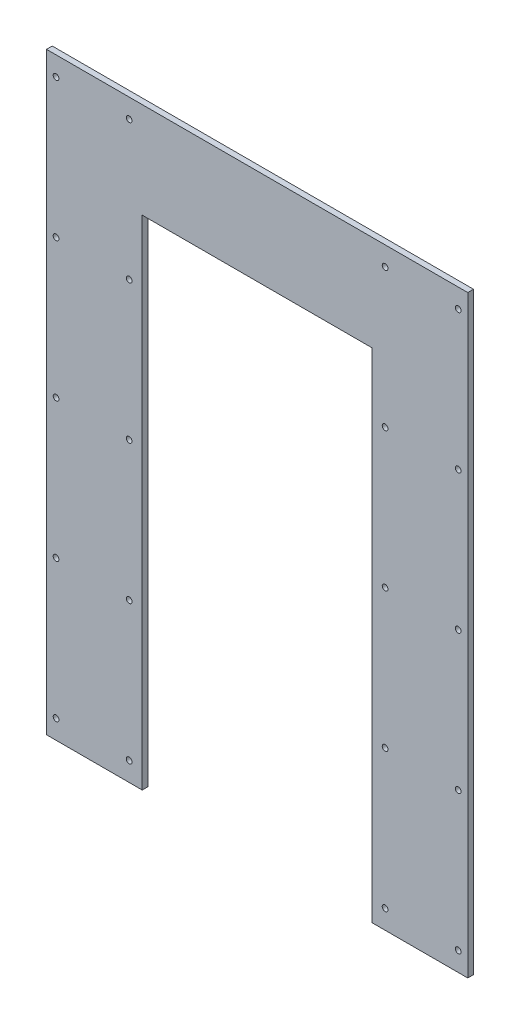
from build123d import *

# Parameters (mm, degrees)
BOSS_EXTRU_1_DEPTH      = 3
ENL_V_MAT_EXTRU_1_REACH = 251.116
ESQUISSE2_R             = 1.5


with BuildPart() as part:
    # Esquisse1 → Boss.-Extru.1 (new body)
    with BuildSketch(Plane.XY):
        Polygon((-25, -155), (25, -155), (25, 105), (145, 105), (145, -155), (195, -155), (195, 155), (145, 155), (25, 155), (-25, 155), align=None)
    extrude(amount=BOSS_EXTRU_1_DEPTH)

    # Esquisse2 → Enlèv. mat.-Extru.1 (cut, up to next)
    with BuildSketch(Plane.XY.offset(3), mode=Mode.PRIVATE) as enl_v_mat_extru_1_sk1:
        with Locations((-20, -145)):
            Circle(ESQUISSE2_R)
    enl_v_mat_extru_1_tool1 = extrude(enl_v_mat_extru_1_sk1.sketch, amount=-ENL_V_MAT_EXTRU_1_REACH, mode=Mode.PRIVATE) & part.part
    # Esquisse2 → Enlèv. mat.-Extru.1 (cut, up to next)
    with BuildSketch(Plane.XY.offset(3), mode=Mode.PRIVATE) as enl_v_mat_extru_1_sk2:
        with Locations((-20, -72.5)):
            Circle(ESQUISSE2_R)
    enl_v_mat_extru_1_tool2 = extrude(enl_v_mat_extru_1_sk2.sketch, amount=-ENL_V_MAT_EXTRU_1_REACH, mode=Mode.PRIVATE) & part.part
    # Esquisse2 → Enlèv. mat.-Extru.1 (cut, up to next)
    with BuildSketch(Plane.XY.offset(3), mode=Mode.PRIVATE) as enl_v_mat_extru_1_sk3:
        with Locations((-20, 0)):
            Circle(ESQUISSE2_R)
    enl_v_mat_extru_1_tool3 = extrude(enl_v_mat_extru_1_sk3.sketch, amount=-ENL_V_MAT_EXTRU_1_REACH, mode=Mode.PRIVATE) & part.part
    # Esquisse2 → Enlèv. mat.-Extru.1 (cut, up to next)
    with BuildSketch(Plane.XY.offset(3), mode=Mode.PRIVATE) as enl_v_mat_extru_1_sk4:
        with Locations((-20, 72.5)):
            Circle(ESQUISSE2_R)
    enl_v_mat_extru_1_tool4 = extrude(enl_v_mat_extru_1_sk4.sketch, amount=-ENL_V_MAT_EXTRU_1_REACH, mode=Mode.PRIVATE) & part.part
    # Esquisse2 → Enlèv. mat.-Extru.1 (cut, up to next)
    with BuildSketch(Plane.XY.offset(3), mode=Mode.PRIVATE) as enl_v_mat_extru_1_sk5:
        with Locations((-20, 145)):
            Circle(ESQUISSE2_R)
    enl_v_mat_extru_1_tool5 = extrude(enl_v_mat_extru_1_sk5.sketch, amount=-ENL_V_MAT_EXTRU_1_REACH, mode=Mode.PRIVATE) & part.part
    # Esquisse2 → Enlèv. mat.-Extru.1 (cut, up to next)
    with BuildSketch(Plane.XY.offset(3), mode=Mode.PRIVATE) as enl_v_mat_extru_1_sk6:
        with Locations((18.166845856, 145)):
            Circle(ESQUISSE2_R)
    enl_v_mat_extru_1_tool6 = extrude(enl_v_mat_extru_1_sk6.sketch, amount=-ENL_V_MAT_EXTRU_1_REACH, mode=Mode.PRIVATE) & part.part
    # Esquisse2 → Enlèv. mat.-Extru.1 (cut, up to next)
    with BuildSketch(Plane.XY.offset(3), mode=Mode.PRIVATE) as enl_v_mat_extru_1_sk7:
        with Locations((18.166845856, 72.5)):
            Circle(ESQUISSE2_R)
    enl_v_mat_extru_1_tool7 = extrude(enl_v_mat_extru_1_sk7.sketch, amount=-ENL_V_MAT_EXTRU_1_REACH, mode=Mode.PRIVATE) & part.part
    # Esquisse2 → Enlèv. mat.-Extru.1 (cut, up to next)
    with BuildSketch(Plane.XY.offset(3), mode=Mode.PRIVATE) as enl_v_mat_extru_1_sk8:
        with Locations((18.166845856, 0)):
            Circle(ESQUISSE2_R)
    enl_v_mat_extru_1_tool8 = extrude(enl_v_mat_extru_1_sk8.sketch, amount=-ENL_V_MAT_EXTRU_1_REACH, mode=Mode.PRIVATE) & part.part
    # Esquisse2 → Enlèv. mat.-Extru.1 (cut, up to next)
    with BuildSketch(Plane.XY.offset(3), mode=Mode.PRIVATE) as enl_v_mat_extru_1_sk9:
        with Locations((18.166845856, -72.5)):
            Circle(ESQUISSE2_R)
    enl_v_mat_extru_1_tool9 = extrude(enl_v_mat_extru_1_sk9.sketch, amount=-ENL_V_MAT_EXTRU_1_REACH, mode=Mode.PRIVATE) & part.part
    # Esquisse2 → Enlèv. mat.-Extru.1 (cut, up to next)
    with BuildSketch(Plane.XY.offset(3), mode=Mode.PRIVATE) as enl_v_mat_extru_1_sk10:
        with Locations((18.166845856, -145)):
            Circle(ESQUISSE2_R)
    enl_v_mat_extru_1_tool10 = extrude(enl_v_mat_extru_1_sk10.sketch, amount=-ENL_V_MAT_EXTRU_1_REACH, mode=Mode.PRIVATE) & part.part
    # Esquisse2 → Enlèv. mat.-Extru.1 (cut, up to next)
    with BuildSketch(Plane.XY.offset(3), mode=Mode.PRIVATE) as enl_v_mat_extru_1_sk11:
        with Locations((151.833154144, -145)):
            Circle(ESQUISSE2_R)
    enl_v_mat_extru_1_tool11 = extrude(enl_v_mat_extru_1_sk11.sketch, amount=-ENL_V_MAT_EXTRU_1_REACH, mode=Mode.PRIVATE) & part.part
    # Esquisse2 → Enlèv. mat.-Extru.1 (cut, up to next)
    with BuildSketch(Plane.XY.offset(3), mode=Mode.PRIVATE) as enl_v_mat_extru_1_sk12:
        with Locations((151.833154144, -72.5)):
            Circle(ESQUISSE2_R)
    enl_v_mat_extru_1_tool12 = extrude(enl_v_mat_extru_1_sk12.sketch, amount=-ENL_V_MAT_EXTRU_1_REACH, mode=Mode.PRIVATE) & part.part
    # Esquisse2 → Enlèv. mat.-Extru.1 (cut, up to next)
    with BuildSketch(Plane.XY.offset(3), mode=Mode.PRIVATE) as enl_v_mat_extru_1_sk13:
        with Locations((151.833154144, 0)):
            Circle(ESQUISSE2_R)
    enl_v_mat_extru_1_tool13 = extrude(enl_v_mat_extru_1_sk13.sketch, amount=-ENL_V_MAT_EXTRU_1_REACH, mode=Mode.PRIVATE) & part.part
    # Esquisse2 → Enlèv. mat.-Extru.1 (cut, up to next)
    with BuildSketch(Plane.XY.offset(3), mode=Mode.PRIVATE) as enl_v_mat_extru_1_sk14:
        with Locations((151.833154144, 72.5)):
            Circle(ESQUISSE2_R)
    enl_v_mat_extru_1_tool14 = extrude(enl_v_mat_extru_1_sk14.sketch, amount=-ENL_V_MAT_EXTRU_1_REACH, mode=Mode.PRIVATE) & part.part
    # Esquisse2 → Enlèv. mat.-Extru.1 (cut, up to next)
    with BuildSketch(Plane.XY.offset(3), mode=Mode.PRIVATE) as enl_v_mat_extru_1_sk15:
        with Locations((151.833154144, 145)):
            Circle(ESQUISSE2_R)
    enl_v_mat_extru_1_tool15 = extrude(enl_v_mat_extru_1_sk15.sketch, amount=-ENL_V_MAT_EXTRU_1_REACH, mode=Mode.PRIVATE) & part.part
    # Esquisse2 → Enlèv. mat.-Extru.1 (cut, up to next)
    with BuildSketch(Plane.XY.offset(3), mode=Mode.PRIVATE) as enl_v_mat_extru_1_sk16:
        with Locations((190, 145)):
            Circle(ESQUISSE2_R)
    enl_v_mat_extru_1_tool16 = extrude(enl_v_mat_extru_1_sk16.sketch, amount=-ENL_V_MAT_EXTRU_1_REACH, mode=Mode.PRIVATE) & part.part
    # Esquisse2 → Enlèv. mat.-Extru.1 (cut, up to next)
    with BuildSketch(Plane.XY.offset(3), mode=Mode.PRIVATE) as enl_v_mat_extru_1_sk17:
        with Locations((190, 72.5)):
            Circle(ESQUISSE2_R)
    enl_v_mat_extru_1_tool17 = extrude(enl_v_mat_extru_1_sk17.sketch, amount=-ENL_V_MAT_EXTRU_1_REACH, mode=Mode.PRIVATE) & part.part
    # Esquisse2 → Enlèv. mat.-Extru.1 (cut, up to next)
    with BuildSketch(Plane.XY.offset(3), mode=Mode.PRIVATE) as enl_v_mat_extru_1_sk18:
        with Locations((190, 0)):
            Circle(ESQUISSE2_R)
    enl_v_mat_extru_1_tool18 = extrude(enl_v_mat_extru_1_sk18.sketch, amount=-ENL_V_MAT_EXTRU_1_REACH, mode=Mode.PRIVATE) & part.part
    # Esquisse2 → Enlèv. mat.-Extru.1 (cut, up to next)
    with BuildSketch(Plane.XY.offset(3), mode=Mode.PRIVATE) as enl_v_mat_extru_1_sk19:
        with Locations((190, -72.5)):
            Circle(ESQUISSE2_R)
    enl_v_mat_extru_1_tool19 = extrude(enl_v_mat_extru_1_sk19.sketch, amount=-ENL_V_MAT_EXTRU_1_REACH, mode=Mode.PRIVATE) & part.part
    # Esquisse2 → Enlèv. mat.-Extru.1 (cut, up to next)
    with BuildSketch(Plane.XY.offset(3), mode=Mode.PRIVATE) as enl_v_mat_extru_1_sk20:
        with Locations((190, -145)):
            Circle(ESQUISSE2_R)
    enl_v_mat_extru_1_tool20 = extrude(enl_v_mat_extru_1_sk20.sketch, amount=-ENL_V_MAT_EXTRU_1_REACH, mode=Mode.PRIVATE) & part.part
    add(enl_v_mat_extru_1_tool1.solids().sort_by_distance((-20, -145, 3))[0], mode=Mode.SUBTRACT)
    add(enl_v_mat_extru_1_tool2.solids().sort_by_distance((-20, -72.5, 3))[0], mode=Mode.SUBTRACT)
    add(enl_v_mat_extru_1_tool3.solids().sort_by_distance((-20, 0, 3))[0], mode=Mode.SUBTRACT)
    add(enl_v_mat_extru_1_tool4.solids().sort_by_distance((-20, 72.5, 3))[0], mode=Mode.SUBTRACT)
    add(enl_v_mat_extru_1_tool5.solids().sort_by_distance((-20, 145, 3))[0], mode=Mode.SUBTRACT)
    add(enl_v_mat_extru_1_tool6.solids().sort_by_distance((18.166846, 145, 3))[0], mode=Mode.SUBTRACT)
    add(enl_v_mat_extru_1_tool7.solids().sort_by_distance((18.166846, 72.5, 3))[0], mode=Mode.SUBTRACT)
    add(enl_v_mat_extru_1_tool8.solids().sort_by_distance((18.166846, 0, 3))[0], mode=Mode.SUBTRACT)
    add(enl_v_mat_extru_1_tool9.solids().sort_by_distance((18.166846, -72.5, 3))[0], mode=Mode.SUBTRACT)
    add(enl_v_mat_extru_1_tool10.solids().sort_by_distance((18.166846, -145, 3))[0], mode=Mode.SUBTRACT)
    add(enl_v_mat_extru_1_tool11.solids().sort_by_distance((151.833154, -145, 3))[0], mode=Mode.SUBTRACT)
    add(enl_v_mat_extru_1_tool12.solids().sort_by_distance((151.833154, -72.5, 3))[0], mode=Mode.SUBTRACT)
    add(enl_v_mat_extru_1_tool13.solids().sort_by_distance((151.833154, 0, 3))[0], mode=Mode.SUBTRACT)
    add(enl_v_mat_extru_1_tool14.solids().sort_by_distance((151.833154, 72.5, 3))[0], mode=Mode.SUBTRACT)
    add(enl_v_mat_extru_1_tool15.solids().sort_by_distance((151.833154, 145, 3))[0], mode=Mode.SUBTRACT)
    add(enl_v_mat_extru_1_tool16.solids().sort_by_distance((190, 145, 3))[0], mode=Mode.SUBTRACT)
    add(enl_v_mat_extru_1_tool17.solids().sort_by_distance((190, 72.5, 3))[0], mode=Mode.SUBTRACT)
    add(enl_v_mat_extru_1_tool18.solids().sort_by_distance((190, 0, 3))[0], mode=Mode.SUBTRACT)
    add(enl_v_mat_extru_1_tool19.solids().sort_by_distance((190, -72.5, 3))[0], mode=Mode.SUBTRACT)
    add(enl_v_mat_extru_1_tool20.solids().sort_by_distance((190, -145, 3))[0], mode=Mode.SUBTRACT)


solid = part.part
